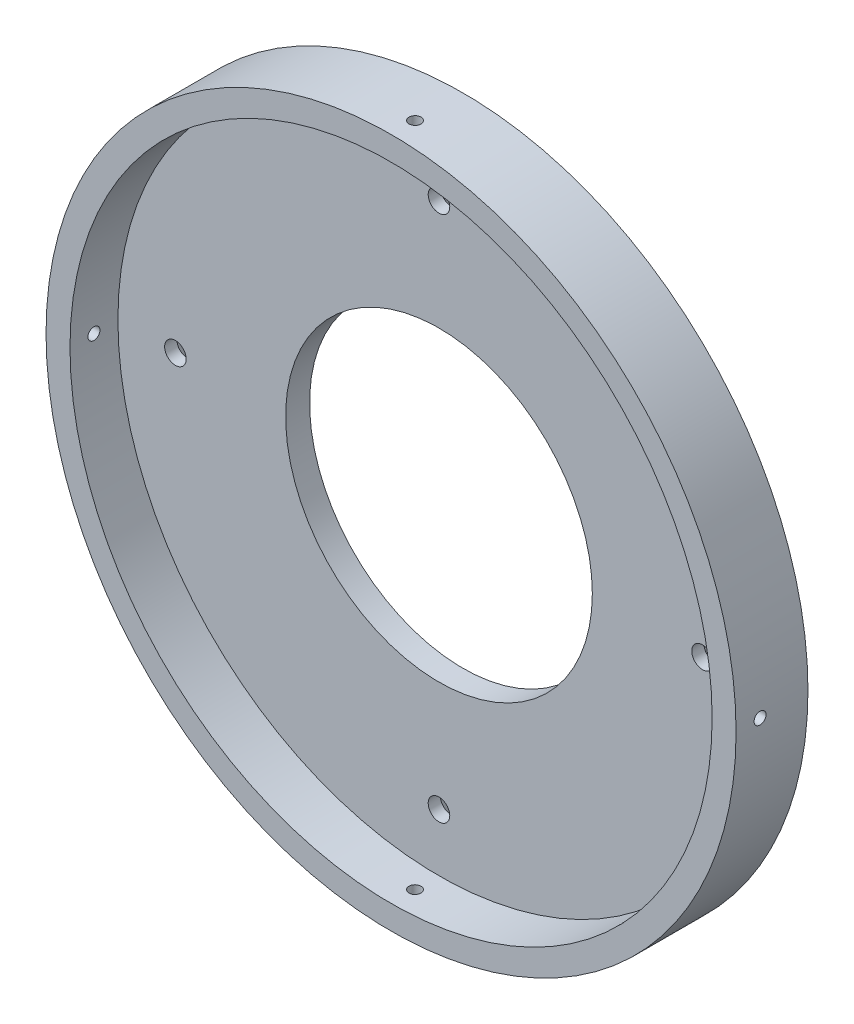
from build123d import *

# Parameters (mm, degrees)
SKETCH1_R                                           = 72
SKETCH1_R_2                                         = 32
BOSS_EXTRUDE1_DEPTH                                 = 5
SKETCH2_R                                           = 72
SKETCH2_R_2                                         = 67
BOSS_EXTRUDE2_DEPTH                                 = 10
CUT_EXTRUDE1_REACH                                  = 104.922
CUT_EXTRUDE1_END_RADIUS                             = 72
SKETCH3_R                                           = 1.25
CIRPATTERN1_COUNT                                   = 4
CSK_FOR_M4_COUNTERSUNK_FLAT_HEAD_SCREW3_D           = 4.5
CSK_FOR_M4_COUNTERSUNK_FLAT_HEAD_SCREW3_CSINK_D     = 9.4
CSK_FOR_M4_COUNTERSUNK_FLAT_HEAD_SCREW3_CSINK_ANGLE = 90


with BuildPart() as part:
    # Sketch1 → Boss-Extrude1 (new body)
    with BuildSketch(Plane.XY):
        Circle(SKETCH1_R)
        Circle(SKETCH1_R_2, mode=Mode.SUBTRACT)
    extrude(amount=BOSS_EXTRUDE1_DEPTH)

    # Sketch2 → Boss-Extrude2 (add)
    with BuildSketch(Plane.XY.offset(5)):
        Circle(SKETCH2_R)
        Circle(SKETCH2_R_2, mode=Mode.SUBTRACT)
    extrude(amount=BOSS_EXTRUDE2_DEPTH)

    # Cut-Extrude1: up to this cylinder (the profile starts inside it)
    cut_extrude1_end = Plane(origin=(0, 0, 10), z_dir=(0, 0, -1)) * Cylinder(CUT_EXTRUDE1_END_RADIUS, 354.844, mode=Mode.PRIVATE)
    # Sketch3 → Cut-Extrude1 (cut, up to the surface)
    with BuildSketch(Plane(origin=(0, 0, 0), x_dir=(1, 0, 0), z_dir=(0, 1, 0)), mode=Mode.PRIVATE) as cut_extrude1_sk1:
        with Locations((0, -10)):
            Circle(SKETCH3_R)
    cut_extrude1_tool1 = extrude(cut_extrude1_sk1.sketch, amount=-CUT_EXTRUDE1_REACH, mode=Mode.PRIVATE) & cut_extrude1_end
    cut_extrude1 = cut_extrude1_tool1.solids().sort_by_distance((0, 0, 10))[0]
    add(cut_extrude1, mode=Mode.SUBTRACT)

    # CirPattern1: Cut-Extrude1 ×4 about axis
    cirpattern1_axis = Axis((0, 0, 5), (0, 0, -1))
    for i in range(1, CIRPATTERN1_COUNT):
        add(cut_extrude1.rotate(cirpattern1_axis, i * 360 / CIRPATTERN1_COUNT), mode=Mode.SUBTRACT)

    # CSK for M4 Countersunk Flat Head Screw3 (through all)
    with Locations(Plane(origin=(0, 0, 0), x_dir=(-1, 0, 0), z_dir=(0, 0, -1))):
        with Locations((0, 55), (55, 0), (0, -55), (-55, 0)):
            CounterSinkHole(CSK_FOR_M4_COUNTERSUNK_FLAT_HEAD_SCREW3_D / 2, CSK_FOR_M4_COUNTERSUNK_FLAT_HEAD_SCREW3_CSINK_D / 2, counter_sink_angle=CSK_FOR_M4_COUNTERSUNK_FLAT_HEAD_SCREW3_CSINK_ANGLE)


solid = part.part
